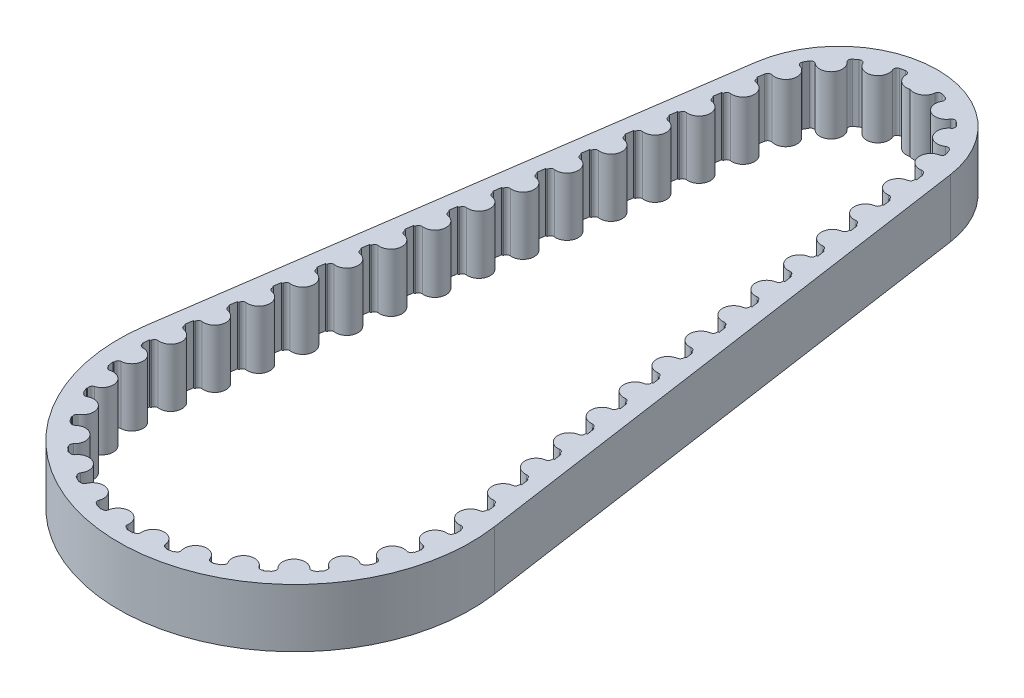
from build123d import *

# Parameters (mm, degrees)
BOSS_EXTRUDE1_DEPTH = 4.5
BOSS_EXTRUDE2_DEPTH = 4.5
CRVPATTERN1_DEPTH   = 4.5


# Read off the part's stored shape, not the designer's step: CrvPattern1
with BuildPart() as part:
    # Sketch3 → Boss-Extrude1 (new body)
    with BuildSketch(Plane(origin=(0, 0, 0), x_dir=(1, 0, 0), z_dir=(0, 1, 0))):
        with BuildLine():
            Line((-7.512151788, 43.084285714), (-13.4506117, 1.941428571))
            ThreePointArc((-13.4506117, 1.941428571), (0, -13.59), (13.4506117, 1.941428571))
            Line((13.4506117, 1.941428571), (7.512151788, 43.084285714))
            ThreePointArc((7.512151788, 43.084285714), (0, 49.59), (-7.512151788, 43.084285714))
        make_face()
        with BuildLine():
            Line((-6.344254672, 42.915714286), (-12.282714584, 1.772857143))
            ThreePointArc((-12.282714584, 1.772857143), (0, -12.41), (12.282714584, 1.772857143))
            Line((12.282714584, 1.772857143), (6.344254672, 42.915714286))
            ThreePointArc((6.344254672, 42.915714286), (0, 48.41), (-6.344254672, 42.915714286))
        make_face(mode=Mode.SUBTRACT)
    extrude(amount=BOSS_EXTRUDE1_DEPTH)

    # Sketch4 → Boss-Extrude2 (add)
    with BuildSketch(Plane(origin=(0, 0, 0), x_dir=(1, 0, 0), z_dir=(0, 1, 0))):
        with BuildLine():
            Line((1.17767288, 48.300887762), (1.286070227, 48.88084467))
            ThreePointArc((1.286070227, 48.88084467), (0, 49), (-1.286070227, 48.88084467))
            Line((-1.286070227, 48.88084467), (-1.17767288, 48.300887762))
            ThreePointArc((-1.17767288, 48.300887762), (-0.965105206, 48.246413442), (-0.869926517, 48.048692719))
            ThreePointArc((-0.869926517, 48.048692719), (0, 47.19), (0.869926517, 48.048692719))
            ThreePointArc((0.869926517, 48.048692719), (0.965105206, 48.246413442), (1.17767288, 48.300887762))
        make_face()
    extrude(amount=BOSS_EXTRUDE2_DEPTH)

    # CrvPattern1 outline → CrvPattern1 (add)
    with BuildSketch(Plane(origin=(0, 0, 0), x_dir=(1, 0, 0), z_dir=(0, 1, 0))):
        with BuildLine():
            ThreePointArc((-1.547307057, 48.220445392), (-2.663815591, 47.830281854), (-3.689636174, 47.241629985))
            ThreePointArc((-3.689636174, 47.241629985), (-3.473655052, 47.280419446), (-3.304917122, 47.1401341))
            ThreePointArc((-3.304917122, 47.1401341), (-2.156817927, 46.720618225), (-1.722415784, 47.863168053))
            ThreePointArc((-1.722415784, 47.863168053), (-1.71801219, 48.082560568), (-1.547307057, 48.220445392))
        make_face()
        with BuildLine():
            ThreePointArc((1.461359103, 47.933623288), (1.575546226, 48.121009969), (1.792445167, 48.154286337))
            ThreePointArc((1.792445167, 48.154286337), (1.48686694, 48.235168539), (1.17767288, 48.300887762))
            ThreePointArc((1.17767288, 48.300887762), (0.965105206, 48.246413442), (0.869926517, 48.048692719))
            ThreePointArc((0.869926517, 48.048692719), (0.697150729, 47.53953784), (0.258105397, 47.229168125))
            ThreePointArc((0.258105397, 47.229168125), (1.03633232, 47.279751684), (1.461359103, 47.933623288))
        make_face()
        with BuildLine():
            ThreePointArc((3.795041136, 46.789688771), (3.976773847, 46.912675312), (4.187885246, 46.852805082))
            ThreePointArc((4.187885246, 46.852805082), (3.225019963, 47.539616074), (2.152360874, 48.03783427))
            ThreePointArc((2.152360874, 48.03783427), (2.30865768, 47.883809027), (2.29143461, 47.665049266))
            ThreePointArc((2.29143461, 47.665049266), (2.611209611, 46.485274169), (3.795041136, 46.789688771))
        make_face()
        with BuildLine():
            ThreePointArc((5.442278798, 44.779398719), (5.658685411, 44.8157394), (5.825823587, 44.673551857))
            ThreePointArc((5.825823587, 44.673551857), (5.235458819, 45.698387616), (4.466856101, 46.597314061))
            ThreePointArc((4.466856101, 46.597314061), (4.545008923, 46.392266253), (4.438433101, 46.200448471))
            ThreePointArc((4.438433101, 46.200448471), (4.239006438, 44.994482328), (5.442278798, 44.779398719))
        make_face()
        with BuildLine():
            Line((6.409991055, 42.010708452), (6.47486537, 42.01081683))
            Line((6.47486537, 42.01081683), (6.344254672, 42.915714286))
            ThreePointArc((6.344254672, 42.915714286), (6.199014182, 43.631049715), (5.973389538, 44.325234918))
            ThreePointArc((5.973389538, 44.325234918), (5.959262149, 44.106253448), (5.782610935, 43.976073511))
            ThreePointArc((5.782610935, 43.976073511), (5.100054763, 42.96205063), (6.105120899, 42.26637298))
            ThreePointArc((6.105120899, 42.26637298), (6.317057938, 42.209494526), (6.409991055, 42.010708452))
        make_face()
        with BuildLine():
            Line((6.789975026, 39.063887425), (6.900881523, 39.059290342))
            Line((6.900881523, 39.059290342), (6.558576781, 41.430847161))
            Line((6.558576781, 41.430847161), (6.45349706, 41.395075153))
            ThreePointArc((6.45349706, 41.395075153), (6.429948277, 41.176905673), (6.247852468, 41.054457384))
            ThreePointArc((6.247852468, 41.054457384), (5.522242303, 40.070783037), (6.496402901, 39.332449467))
            ThreePointArc((6.496402901, 39.332449467), (6.705692621, 39.266492813), (6.789975026, 39.063887425))
        make_face()
        with BuildLine():
            Line((7.218546455, 36.094657469), (7.329452951, 36.090060386))
            Line((7.329452951, 36.090060386), (6.987148209, 38.461617205))
            Line((6.987148209, 38.461617205), (6.882068489, 38.425845197))
            ThreePointArc((6.882068489, 38.425845197), (6.858519705, 38.207675717), (6.676423896, 38.085227428))
            ThreePointArc((6.676423896, 38.085227428), (5.950813732, 37.101553081), (6.92497433, 36.363219512))
            ThreePointArc((6.92497433, 36.363219512), (7.13426405, 36.297262858), (7.218546455, 36.094657469))
        make_face()
        with BuildLine():
            Line((7.647117883, 33.125427513), (7.75802438, 33.12083043))
            Line((7.75802438, 33.12083043), (7.415719638, 35.492387249))
            Line((7.415719638, 35.492387249), (7.310639918, 35.456615241))
            ThreePointArc((7.310639918, 35.456615241), (7.287091134, 35.238445761), (7.104995325, 35.115997472))
            ThreePointArc((7.104995325, 35.115997472), (6.37938516, 34.132323126), (7.353545758, 33.393989556))
            ThreePointArc((7.353545758, 33.393989556), (7.562835479, 33.328032902), (7.647117883, 33.125427513))
        make_face()
        with BuildLine():
            Line((8.075689312, 30.156197557), (8.186595809, 30.151600474))
            Line((8.186595809, 30.151600474), (7.844291066, 32.523157293))
            Line((7.844291066, 32.523157293), (7.739211346, 32.487385285))
            ThreePointArc((7.739211346, 32.487385285), (7.715662562, 32.269215805), (7.533566753, 32.146767516))
            ThreePointArc((7.533566753, 32.146767516), (6.807956589, 31.163093169), (7.782117187, 30.4247596))
            ThreePointArc((7.782117187, 30.4247596), (7.991406907, 30.358802946), (8.075689312, 30.156197557))
        make_face()
        with BuildLine():
            Line((8.50426074, 27.186967601), (8.615167237, 27.182370519))
            Line((8.615167237, 27.182370519), (8.272862495, 29.553927338))
            Line((8.272862495, 29.553927338), (8.167782775, 29.51815533))
            ThreePointArc((8.167782775, 29.51815533), (8.144233991, 29.29998585), (7.962138182, 29.17753756))
            ThreePointArc((7.962138182, 29.17753756), (7.236528017, 28.193863214), (8.210688615, 27.455529644))
            ThreePointArc((8.210688615, 27.455529644), (8.419978336, 27.38957299), (8.50426074, 27.186967601))
        make_face()
        with BuildLine():
            Line((8.932832169, 24.217737646), (9.043738666, 24.213140563))
            Line((9.043738666, 24.213140563), (8.701433924, 26.584697382))
            Line((8.701433924, 26.584697382), (8.596354203, 26.548925374))
            ThreePointArc((8.596354203, 26.548925374), (8.57280542, 26.330755893), (8.39070961, 26.208307604))
            ThreePointArc((8.39070961, 26.208307604), (7.665099446, 25.224633257), (8.639260044, 24.486299688))
            ThreePointArc((8.639260044, 24.486299688), (8.848549764, 24.420343034), (8.932832169, 24.217737646))
        make_face()
        with BuildLine():
            Line((9.361403597, 21.24850769), (9.472310094, 21.243910607))
            Line((9.472310094, 21.243910607), (9.130005352, 23.615467426))
            Line((9.130005352, 23.615467426), (9.024925632, 23.579695418))
            ThreePointArc((9.024925632, 23.579695418), (9.001376848, 23.361525938), (8.819281039, 23.239077649))
            ThreePointArc((8.819281039, 23.239077649), (8.093670875, 22.255403302), (9.067831473, 21.517069732))
            ThreePointArc((9.067831473, 21.517069732), (9.277121193, 21.451113078), (9.361403597, 21.24850769))
        make_face()
        with BuildLine():
            Line((9.789975026, 18.279277734), (9.900881523, 18.274680651))
            Line((9.900881523, 18.274680651), (9.558576781, 20.64623747))
            Line((9.558576781, 20.64623747), (9.45349706, 20.610465462))
            ThreePointArc((9.45349706, 20.610465462), (9.429948277, 20.392295982), (9.247852468, 20.269847693))
            ThreePointArc((9.247852468, 20.269847693), (8.522242303, 19.286173347), (9.496402901, 18.547839777))
            ThreePointArc((9.496402901, 18.547839777), (9.705692621, 18.481883123), (9.789975026, 18.279277734))
        make_face()
        with BuildLine():
            Line((10.218546455, 15.310047778), (10.329452951, 15.305450695))
            Line((10.329452951, 15.305450695), (9.987148209, 17.677007514))
            Line((9.987148209, 17.677007514), (9.882068489, 17.641235506))
            ThreePointArc((9.882068489, 17.641235506), (9.858519705, 17.423066026), (9.676423896, 17.300617737))
            ThreePointArc((9.676423896, 17.300617737), (8.950813732, 16.31694339), (9.92497433, 15.578609821))
            ThreePointArc((9.92497433, 15.578609821), (10.13426405, 15.512653167), (10.218546455, 15.310047778))
        make_face()
        with BuildLine():
            Line((10.647117883, 12.340817822), (10.75802438, 12.336220739))
            Line((10.75802438, 12.336220739), (10.415719638, 14.707777558))
            Line((10.415719638, 14.707777558), (10.310639918, 14.67200555))
            ThreePointArc((10.310639918, 14.67200555), (10.287091134, 14.45383607), (10.104995325, 14.331387781))
            ThreePointArc((10.104995325, 14.331387781), (9.37938516, 13.347713435), (10.353545758, 12.609379865))
            ThreePointArc((10.353545758, 12.609379865), (10.562835479, 12.543423211), (10.647117883, 12.340817822))
        make_face()
        with BuildLine():
            Line((11.075689312, 9.371587866), (11.186595809, 9.366990784))
            Line((11.186595809, 9.366990784), (10.844291066, 11.738547603))
            Line((10.844291066, 11.738547603), (10.739211346, 11.702775595))
            ThreePointArc((10.739211346, 11.702775595), (10.715662562, 11.484606115), (10.533566753, 11.362157825))
            ThreePointArc((10.533566753, 11.362157825), (9.807956589, 10.378483478), (10.782117187, 9.640149909))
            ThreePointArc((10.782117187, 9.640149909), (10.991406907, 9.574193255), (11.075689312, 9.371587866))
        make_face()
        with BuildLine():
            Line((11.50426074, 6.402357911), (11.615167237, 6.397760828))
            Line((11.615167237, 6.397760828), (11.272862495, 8.769317647))
            Line((11.272862495, 8.769317647), (11.167782775, 8.733545639))
            ThreePointArc((11.167782775, 8.733545639), (11.144233991, 8.515376159), (10.962138182, 8.392927869))
            ThreePointArc((10.962138182, 8.392927869), (10.236528017, 7.409253523), (11.210688615, 6.670919953))
            ThreePointArc((11.210688615, 6.670919953), (11.419978335, 6.6049633), (11.50426074, 6.402357911))
        make_face()
        with BuildLine():
            Line((11.932832169, 3.433127955), (12.043738666, 3.428530872))
            Line((12.043738666, 3.428530872), (11.701433924, 5.800087691))
            Line((11.701433924, 5.800087691), (11.596354203, 5.764315683))
            ThreePointArc((11.596354203, 5.764315683), (11.57280542, 5.546146203), (11.39070961, 5.423697914))
            ThreePointArc((11.39070961, 5.423697914), (10.665099446, 4.440023567), (11.639260044, 3.701689997))
            ThreePointArc((11.639260044, 3.701689997), (11.848549764, 3.635733343), (11.932832169, 3.433127955))
        make_face()
        with BuildLine():
            Line((12.348227601, 0.469071688), (12.401234635, 0.466346994))
            ThreePointArc((12.401234635, 0.466346994), (12.359250764, 1.121169275), (12.282714584, 1.772857143))
            Line((12.282714584, 1.772857143), (12.129461267, 2.834627271))
            Line((12.129461267, 2.834627271), (12.034916689, 2.803485943))
            ThreePointArc((12.034916689, 2.803485943), (12.009202478, 2.585561079), (11.825899644, 2.464927177))
            ThreePointArc((11.825899644, 2.464927177), (11.090556628, 1.488507196), (12.057336977, 0.740535881))
            ThreePointArc((12.057336977, 0.740535881), (12.265961378, 0.672504074), (12.348227601, 0.469071688))
        make_face()
        with BuildLine():
            Line((12.128174313, -2.367729074), (12.179152961, -2.382505647))
            ThreePointArc((12.179152961, -2.382505647), (12.351238386, -1.206238088), (12.409985605, -0.018901771))
            Line((12.409985605, -0.018901771), (12.357111281, -0.023535927))
            ThreePointArc((12.357111281, -0.023535927), (12.282233558, -0.229802245), (12.076197785, -0.305312028))
            ThreePointArc((12.076197785, -0.305312028), (11.137015112, -1.087655456), (11.907086021, -2.036926822))
            ThreePointArc((11.907086021, -2.036926822), (12.09461927, -2.15087307), (12.128174313, -2.367729074))
        make_face()
        with BuildLine():
            Line((11.265103164, -5.078996343), (11.311350612, -5.105041364))
            ThreePointArc((11.311350612, -5.105041364), (11.74791766, -3.999316273), (12.076682731, -2.856892405))
            Line((12.076682731, -2.856892405), (12.024150112, -2.849309957))
            ThreePointArc((12.024150112, -2.849309957), (11.904078784, -3.032981794), (11.686233783, -3.059364042))
            ThreePointArc((11.686233783, -3.059364042), (10.593005529, -3.606152223), (11.125538977, -4.706394677))
            ThreePointArc((11.125538977, -4.706394677), (11.28203834, -4.860214106), (11.265103164, -5.078996343))
        make_face()
        with BuildLine():
            Line((9.804772909, -7.520982738), (9.843837187, -7.556915339))
            ThreePointArc((9.843837187, -7.556915339), (10.521739718, -6.580356624), (11.103092003, -5.543414829))
            Line((11.103092003, -5.543414829), (11.053686291, -5.524017789))
            ThreePointArc((11.053686291, -5.524017789), (10.894787361, -5.675357134), (10.676682953, -5.651213099))
            ThreePointArc((10.676682953, -5.651213099), (9.487370463, -5.933456134), (9.754132314, -7.126336449))
            ThreePointArc((9.754132314, -7.126336449), (9.871300425, -7.311873779), (9.804772909, -7.520982738))
        make_face()
        with BuildLine():
            Line((7.824608098, -9.564217755), (7.854418075, -9.608132842))
            ThreePointArc((7.854418075, -9.608132842), (8.7377147, -8.812516202), (9.540831761, -7.9360336))
            Line((9.540831761, -7.9360336), (9.497172374, -7.905850368))
            ThreePointArc((9.497172374, -7.905850368), (9.30787043, -8.016833435), (9.101070187, -7.943443197))
            ThreePointArc((9.101070187, -7.943443197), (7.878729049, -7.946176978), (7.865575984, -9.168450404))
            ThreePointArc((7.865575984, -9.168450404), (7.937200765, -9.375868721), (7.824608098, -9.564217755))
        make_face()
        with BuildLine():
            Line((5.42959414, -11.100372094), (5.448569336, -11.149941354))
            ThreePointArc((5.448569336, -11.149941354), (6.490428975, -10.577449207), (7.472730733, -9.907895609))
            Line((7.472730733, -9.907895609), (7.437132427, -9.868526456))
            ThreePointArc((7.437132427, -9.868526456), (7.227463976, -9.933269086), (7.042932142, -9.814523688))
            ThreePointArc((7.042932142, -9.814523688), (5.852369076, -9.537603273), (5.559998451, -10.724466681))
            ThreePointArc((5.559998451, -10.724466681), (5.582282461, -10.942768972), (5.42959414, -11.100372094))
        make_face()
        with BuildLine():
            Line((2.746711133, -12.048001124), (2.75384551, -12.100596469))
            ThreePointArc((2.75384551, -12.100596469), (3.899030306, -11.781581501), (5.008436576, -11.354455648))
            Line((5.008436576, -11.354455648), (4.982786719, -11.307987869))
            ThreePointArc((4.982786719, -11.307987869), (4.763868074, -11.323057504), (4.611388253, -11.165252651))
            ThreePointArc((4.611388253, -11.165252651), (3.515725151, -10.623359952), (2.959638025, -11.711887599))
            ThreePointArc((2.959638025, -11.711887599), (2.931399799, -11.9294998), (2.746711133, -12.048001124))
        make_face()
        with BuildLine():
            Line((-0.081798435, -12.356862958), (-0.08688313, -12.409695859))
            ThreePointArc((-0.08688313, -12.409695859), (1.100910818, -12.361071773), (2.278602519, -12.199019246))
            Line((2.278602519, -12.199019246), (2.264261031, -12.147916493))
            ThreePointArc((2.264261031, -12.147916493), (2.047698933, -12.112514162), (1.935355381, -11.924016434))
            ThreePointArc((1.935355381, -11.924016434), (0.992682679, -11.1458818), (0.202361969, -12.078361562))
            ThreePointArc((0.202361969, -12.078361562), (0.125098656, -12.283746195), (-0.081798435, -12.356862958))
        make_face()
        with BuildLine():
            Line((-2.905971172, -12.010582196), (-2.923005356, -12.060851532))
            ThreePointArc((-2.923005356, -12.060851532), (-1.755577333, -12.285196304), (-0.572039672, -12.396808888))
            Line((-0.572039672, -12.396808888), (-0.574312427, -12.343780555))
            ThreePointArc((-0.574312427, -12.343780555), (-0.777036175, -12.259783238), (-0.843287171, -12.050586505))
            ThreePointArc((-0.843287171, -12.050586505), (-1.582990359, -11.077465483), (-2.565643019, -11.804458661))
            ThreePointArc((-2.565643019, -11.804458661), (-2.687835033, -11.986726538), (-2.905971172, -12.010582196))
        make_face()
        with BuildLine():
            Line((-5.576073615, -11.027518133), (-5.604154162, -11.072558698))
            ThreePointArc((-5.604154162, -11.072558698), (-4.518987371, -11.5579779), (-3.392353165, -11.937338062))
            Line((-3.392353165, -11.937338062), (-3.382436691, -11.885195631))
            ThreePointArc((-3.382436691, -11.885195631), (-3.560573976, -11.757056741), (-3.577219885, -11.538252306))
            ThreePointArc((-3.577219885, -11.538252306), (-4.074735591, -10.421738332), (-5.19762141, -10.904700824))
            ThreePointArc((-5.19762141, -10.904700824), (-5.358263685, -11.054188371), (-5.576073615, -11.027518133))
        make_face()
        with BuildLine():
            Line((-7.950540884, -9.459791372), (-7.988179004, -9.497215181))
            ThreePointArc((-7.988179004, -9.497215181), (-7.042807383, -10.217972605), (-6.032809113, -10.84496723))
            Line((-6.032809113, -10.84496723), (-6.011229164, -10.796475216))
            ThreePointArc((-6.011229164, -10.796475216), (-6.155335411, -10.630988488), (-6.121493692, -10.414177037))
            ThreePointArc((-6.121493692, -10.414177037), (-6.350444369, -9.213466032), (-7.554029602, -9.42679188))
            ThreePointArc((-7.554029602, -9.42679188), (-7.744605122, -9.535573488), (-7.950540884, -9.459791372))
        make_face()
        with BuildLine():
            Line((-9.903482236, -7.390520465), (-9.948682412, -7.418343364))
            ThreePointArc((-9.948682412, -7.418343364), (-9.193228166, -8.336225518), (-8.353414445, -9.177612277))
            Line((-8.353414445, -9.177612277), (-8.32131516, -9.135341655))
            ThreePointArc((-8.32131516, -9.135341655), (-8.423750068, -8.941280951), (-8.341214958, -8.737957507))
            ThreePointArc((-8.341214958, -8.737957507), (-8.28946198, -7.516709391), (-9.509934319, -7.449088376))
            ThreePointArc((-9.509934319, -7.449088376), (-9.720339052, -7.511396605), (-9.903482236, -7.390520465))
        make_face()
        with BuildLine():
            Line((-11.33135561, -4.929415095), (-11.381721395, -4.946161956))
            ThreePointArc((-11.381721395, -4.946161956), (-10.856237591, -6.012504085), (-10.2311341, -7.023673898))
            Line((-10.2311341, -7.023673898), (-10.190217334, -6.989865794))
            ThreePointArc((-10.190217334, -6.989865794), (-10.245549957, -6.777519925), (-10.118697347, -6.598464396))
            ThreePointArc((-10.118697347, -6.598464396), (-9.78898458, -5.421427938), (-10.961636386, -5.076445224))
            ThreePointArc((-10.961636386, -5.076445224), (-11.180714985, -5.088976586), (-11.33135561, -4.929415095))
        make_face()
        with BuildLine():
            Line((-12.158457271, -2.20695943), (-12.211318346, -2.211742357))
            ThreePointArc((-12.211318346, -2.211742357), (-11.943665358, -3.37000858), (-11.56641416, -4.497350719))
            Line((-11.56641416, -4.497350719), (-11.51884926, -4.473797588))
            ThreePointArc((-11.51884926, -4.473797588), (-11.524145943, -4.254424818), (-11.35970137, -4.109130463))
            ThreePointArc((-11.35970137, -4.109130463), (-10.769509698, -3.038710396), (-11.832168707, -2.434656457))
            ThreePointArc((-11.832168707, -2.434656457), (-12.048305947, -2.396746555), (-12.158457271, -2.20695943))
        make_face()
        with BuildLine():
            Line((-12.340935514, 0.63250596), (-12.393489262, 0.63994055))
            ThreePointArc((-12.393489262, 0.63994055), (-12.397857655, -0.548840204), (-12.28846005, -1.732584657))
            Line((-12.28846005, -1.732584657), (-12.236768838, -1.720535252))
            ThreePointArc((-12.236768838, -1.720535252), (-12.191748759, -1.5057664), (-11.998430831, -1.401936512))
            ThreePointArc((-11.998430831, -1.401936512), (-11.179051342, -0.494884923), (-12.075376946, 0.336214194))
            ThreePointArc((-12.075376946, 0.336214194), (-12.277113552, 0.422555431), (-12.340935514, 0.63250596))
        make_face()
        with BuildLine():
            Line((-11.926288109, 3.478466534), (-12.031367829, 3.514238542))
            Line((-12.031367829, 3.514238542), (-12.282714584, 1.772857143))
            ThreePointArc((-12.282714584, 1.772857143), (-12.323985808, 1.458586234), (-12.357217293, 1.143363795))
            Line((-12.357217293, 1.143363795), (-12.262766074, 1.147278805))
            ThreePointArc((-12.262766074, 1.147278805), (-12.17848367, 1.349884194), (-11.969193949, 1.415840848))
            ThreePointArc((-11.969193949, 1.415840848), (-10.995033351, 2.154174418), (-11.720643516, 3.137848764))
            ThreePointArc((-11.720643516, 3.137848764), (-11.902739325, 3.260297054), (-11.926288109, 3.478466534))
        make_face()
        with BuildLine():
            Line((-11.49771668, 6.447696489), (-11.602796401, 6.483468497))
            Line((-11.602796401, 6.483468497), (-11.945101143, 4.111911678))
            Line((-11.945101143, 4.111911678), (-11.834194646, 4.116508761))
            ThreePointArc((-11.834194646, 4.116508761), (-11.749912241, 4.31911415), (-11.540622521, 4.385070804))
            ThreePointArc((-11.540622521, 4.385070804), (-10.566461923, 5.123404373), (-11.292072087, 6.10707872))
            ThreePointArc((-11.292072087, 6.10707872), (-11.474167896, 6.229527009), (-11.49771668, 6.447696489))
        make_face()
        with BuildLine():
            Line((-11.069145252, 9.416926445), (-11.174224972, 9.452698453))
            Line((-11.174224972, 9.452698453), (-11.516529714, 7.081141634))
            Line((-11.516529714, 7.081141634), (-11.405623217, 7.085738717))
            ThreePointArc((-11.405623217, 7.085738717), (-11.321340813, 7.288344106), (-11.112051092, 7.35430076))
            ThreePointArc((-11.112051092, 7.35430076), (-10.137890494, 8.09263433), (-10.863500659, 9.076308676))
            ThreePointArc((-10.863500659, 9.076308676), (-11.045596468, 9.198756965), (-11.069145252, 9.416926445))
        make_face()
        with BuildLine():
            Line((-10.640573823, 12.386156401), (-10.745653543, 12.421928409))
            Line((-10.745653543, 12.421928409), (-11.087958285, 10.05037159))
            Line((-11.087958285, 10.05037159), (-10.977051789, 10.054968673))
            ThreePointArc((-10.977051789, 10.054968673), (-10.892769384, 10.257574061), (-10.683479664, 10.323530716))
            ThreePointArc((-10.683479664, 10.323530716), (-9.709319066, 11.061864285), (-10.43492923, 12.045538632))
            ThreePointArc((-10.43492923, 12.045538632), (-10.617025039, 12.167986921), (-10.640573823, 12.386156401))
        make_face()
        with BuildLine():
            Line((-10.212002394, 15.355386357), (-10.317082115, 15.391158365))
            Line((-10.317082115, 15.391158365), (-10.659386857, 13.019601546))
            Line((-10.659386857, 13.019601546), (-10.54848036, 13.024198629))
            ThreePointArc((-10.54848036, 13.024198629), (-10.464197955, 13.226804017), (-10.254908235, 13.292760671))
            ThreePointArc((-10.254908235, 13.292760671), (-9.280747637, 14.031094241), (-10.006357802, 15.014768588))
            ThreePointArc((-10.006357802, 15.014768588), (-10.188453611, 15.137216877), (-10.212002394, 15.355386357))
        make_face()
        with BuildLine():
            Line((-9.783430966, 18.324616313), (-9.888510686, 18.360388321))
            Line((-9.888510686, 18.360388321), (-10.230815428, 15.988831502))
            Line((-10.230815428, 15.988831502), (-10.119908931, 15.993428585))
            ThreePointArc((-10.119908931, 15.993428585), (-10.035626527, 16.196033973), (-9.826336807, 16.261990627))
            ThreePointArc((-9.826336807, 16.261990627), (-8.852176209, 17.000324196), (-9.577786373, 17.983998543))
            ThreePointArc((-9.577786373, 17.983998543), (-9.759882182, 18.106446833), (-9.783430966, 18.324616313))
        make_face()
        with BuildLine():
            Line((-9.354859537, 21.293846269), (-9.459939258, 21.329618277))
            Line((-9.459939258, 21.329618277), (-9.802244, 18.958061458))
            Line((-9.802244, 18.958061458), (-9.691337503, 18.96265854))
            ThreePointArc((-9.691337503, 18.96265854), (-9.607055098, 19.165263929), (-9.397765378, 19.231220583))
            ThreePointArc((-9.397765378, 19.231220583), (-8.42360478, 19.969554152), (-9.149214944, 20.953228499))
            ThreePointArc((-9.149214944, 20.953228499), (-9.331310754, 21.075676788), (-9.354859537, 21.293846269))
        make_face()
        with BuildLine():
            Line((-8.926288109, 24.263076224), (-9.031367829, 24.298848232))
            Line((-9.031367829, 24.298848232), (-9.373672571, 21.927291413))
            Line((-9.373672571, 21.927291413), (-9.262766074, 21.931888496))
            ThreePointArc((-9.262766074, 21.931888496), (-9.17848367, 22.134493885), (-8.969193949, 22.200450539))
            ThreePointArc((-8.969193949, 22.200450539), (-7.995033351, 22.938784109), (-8.720643516, 23.922458455))
            ThreePointArc((-8.720643516, 23.922458455), (-8.902739325, 24.044906744), (-8.926288109, 24.263076224))
        make_face()
        with BuildLine():
            Line((-8.49771668, 27.23230618), (-8.602796401, 27.268078188))
            Line((-8.602796401, 27.268078188), (-8.945101142, 24.896521369))
            Line((-8.945101142, 24.896521369), (-8.834194646, 24.901118452))
            ThreePointArc((-8.834194646, 24.901118452), (-8.749912241, 25.103723841), (-8.540622521, 25.169680495))
            ThreePointArc((-8.540622521, 25.169680495), (-7.566461923, 25.908014064), (-8.292072087, 26.891688411))
            ThreePointArc((-8.292072087, 26.891688411), (-8.474167896, 27.0141367), (-8.49771668, 27.23230618))
        make_face()
        with BuildLine():
            Line((-8.069145252, 30.201536136), (-8.174224972, 30.237308144))
            Line((-8.174224972, 30.237308144), (-8.516529714, 27.865751325))
            Line((-8.516529714, 27.865751325), (-8.405623217, 27.870348408))
            ThreePointArc((-8.405623217, 27.870348408), (-8.321340812, 28.072953797), (-8.112051092, 28.138910451))
            ThreePointArc((-8.112051092, 28.138910451), (-7.137890494, 28.877244021), (-7.863500659, 29.860918367))
            ThreePointArc((-7.863500659, 29.860918367), (-8.045596468, 29.983366656), (-8.069145252, 30.201536136))
        make_face()
        with BuildLine():
            Line((-7.640573823, 33.170766092), (-7.745653543, 33.2065381))
            Line((-7.745653543, 33.2065381), (-8.087958285, 30.834981281))
            Line((-8.087958285, 30.834981281), (-7.977051789, 30.839578364))
            ThreePointArc((-7.977051789, 30.839578364), (-7.892769384, 31.042183752), (-7.683479664, 31.108140406))
            ThreePointArc((-7.683479664, 31.108140406), (-6.709319066, 31.846473976), (-7.43492923, 32.830148323))
            ThreePointArc((-7.43492923, 32.830148323), (-7.617025039, 32.952596612), (-7.640573823, 33.170766092))
        make_face()
        with BuildLine():
            Line((-7.212002394, 36.139996048), (-7.317082115, 36.175768056))
            Line((-7.317082115, 36.175768056), (-7.659386857, 33.804211237))
            Line((-7.659386857, 33.804211237), (-7.54848036, 33.80880832))
            ThreePointArc((-7.54848036, 33.80880832), (-7.464197955, 34.011413708), (-7.254908235, 34.077370362))
            ThreePointArc((-7.254908235, 34.077370362), (-6.280747637, 34.815703932), (-7.006357802, 35.799378278))
            ThreePointArc((-7.006357802, 35.799378278), (-7.188453611, 35.921826568), (-7.212002394, 36.139996048))
        make_face()
        with BuildLine():
            Line((-6.783430966, 39.109226004), (-6.888510686, 39.144998012))
            Line((-6.888510686, 39.144998012), (-7.230815428, 36.773441193))
            Line((-7.230815428, 36.773441193), (-7.119908931, 36.778038275))
            ThreePointArc((-7.119908931, 36.778038275), (-7.035626527, 36.980643664), (-6.826336807, 37.046600318))
            ThreePointArc((-6.826336807, 37.046600318), (-5.852176209, 37.784933887), (-6.577786373, 38.768608234))
            ThreePointArc((-6.577786373, 38.768608234), (-6.759882182, 38.891056524), (-6.783430966, 39.109226004))
        make_face()
        with BuildLine():
            Line((-6.354859537, 42.078455959), (-6.459939258, 42.114227967))
            Line((-6.459939258, 42.114227967), (-6.802244, 39.742671148))
            Line((-6.802244, 39.742671148), (-6.691337503, 39.747268231))
            ThreePointArc((-6.691337503, 39.747268231), (-6.607055098, 39.94987362), (-6.397765378, 40.015830274))
            ThreePointArc((-6.397765378, 40.015830274), (-5.42360478, 40.754163843), (-6.149214944, 41.73783819))
            ThreePointArc((-6.149214944, 41.73783819), (-6.331310754, 41.860286479), (-6.354859537, 42.078455959))
        make_face()
        with BuildLine():
            ThreePointArc((-5.559904097, 44.535926297), (-5.722876841, 44.68286966), (-5.715370779, 44.902177951))
            ThreePointArc((-5.715370779, 44.902177951), (-6.111067908, 43.934670262), (-6.344254672, 42.915714286))
            Line((-6.344254672, 42.915714286), (-6.383690874, 42.642492267))
            Line((-6.383690874, 42.642492267), (-6.377779228, 42.641897284))
            ThreePointArc((-6.377779228, 42.641897284), (-6.265721848, 42.830565275), (-6.049213722, 42.866296196))
            ThreePointArc((-6.049213722, 42.866296196), (-4.980524246, 43.459615785), (-5.559904097, 44.535926297))
        make_face()
        with BuildLine():
            ThreePointArc((-4.003208731, 46.617117674), (-4.09037675, 46.818498417), (-3.992411181, 47.014853234))
            ThreePointArc((-3.992411181, 47.014853234), (-4.845802091, 46.195986427), (-5.534220672, 45.234269864))
            ThreePointArc((-5.534220672, 45.234269864), (-5.353892615, 45.359306895), (-5.142116643, 45.301831641))
            ThreePointArc((-5.142116643, 45.301831641), (-3.923512145, 45.397374346), (-4.003208731, 46.617117674))
        make_face()
    extrude(amount=CRVPATTERN1_DEPTH)


solid = part.part
